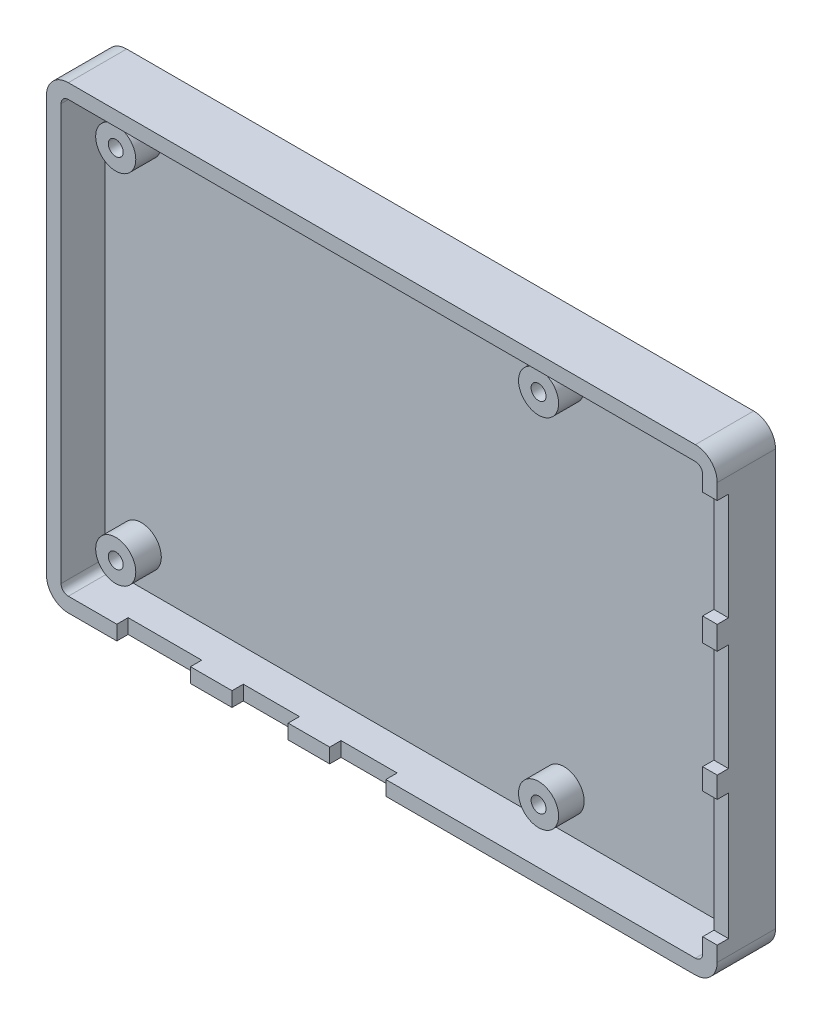
from build123d import *

# Parameters (mm, degrees)
CASEENVELOPE_W                       = 92
CASEENVELOPE_H                       = 63
BOTTOM_ENVELOPE_DEPTH                = 8
OUTSIDE_R3_R                         = 3
SHELL_1_T                            = -2
SIDEPORT_CLEARANCE_1_START           = 6.45
SIDEPORT_PROFILE_1_W                 = 10.1
SIDEPORT_PROFILE_1_H                 = 13
SIDEPORT_CLEARANCE_1_DEPTH           = 4.5
SIDEPORT_CLEARANCE_2_START           = 6.45
SIDEPORT_PROFILE_2_W                 = 7.7
SIDEPORT_PROFILE_2_H                 = 13
SIDEPORT_CLEARANCE_2_DEPTH           = 4.7
SIDEPORT_CLEARANCE_3_START           = 6.45
SIDEPORT_PROFILE_3_W                 = 7.7
SIDEPORT_PROFILE_3_H                 = 13
SIDEPORT_CLEARANCE_3_DEPTH           = 4.7
ENDPORT_CLEARANCE_1_START            = 6.45
ENDPORT_PROFILE_1_W                  = 11
ENDPORT_PROFILE_1_H                  = 17.3
ENDPORT_CLEARANCE_1_DEPTH            = 14.6
ENDPORT_CLEARANCE_2_START            = 6.45
ENDPORT_PROFILE_2_W                  = 11
ENDPORT_PROFILE_2_H                  = 14.7
ENDPORT_CLEARANCE_2_DEPTH            = 16.3
ENDPORT_CLEARANCE_3_START            = 6.45
ENDPORT_PROFILE_3_W                  = 11
ENDPORT_PROFILE_3_H                  = 14.7
ENDPORT_CLEARANCE_3_DEPTH            = 16.3
FOUR_M2P5_STANDOFFS_2P05_PILOT_START = 2
STANDOFF_RINGS_R                     = 2.75
STANDOFF_RINGS_R_2                   = 1.025
FOUR_M2P5_STANDOFFS_2P05_PILOT_DEPTH = 3.5


with BuildPart() as part:
    # CaseEnvelope → Bottom_Envelope (new body)
    with BuildSketch(Plane.XY):
        Rectangle(CASEENVELOPE_W, CASEENVELOPE_H)
    extrude(amount=BOTTOM_ENVELOPE_DEPTH)

    # Outside_R3
    outside_r3_edges = [part.edges().sort_by_distance(p)[0] for p in [
        (46, 31.5, 4),
        (46, -31.5, 4),
        (-46, 31.5, 4),
        (-46, -31.5, 4),
    ]]
    fillet(outside_r3_edges, radius=OUTSIDE_R3_R)

    # 抽壳1
    shell_1_openings = [part.faces().sort_by_distance(p)[0] for p in [
        (0, 0, 8),
    ]]
    offset(amount=SHELL_1_T, openings=shell_1_openings, kind=Kind.INTERSECTION)

    # SidePort_Profile_1 → SidePort_Clearance_1 (cut)
    with BuildSketch(Plane.XY.offset(SIDEPORT_CLEARANCE_1_START)):
        with Locations((-31.3, -33.5)):
            Rectangle(SIDEPORT_PROFILE_1_W, SIDEPORT_PROFILE_1_H)
    extrude(amount=SIDEPORT_CLEARANCE_1_DEPTH, mode=Mode.SUBTRACT)

    # SidePort_Profile_2 → SidePort_Clearance_2 (cut)
    with BuildSketch(Plane.XY.offset(SIDEPORT_CLEARANCE_2_START)):
        with Locations((-16.7, -33.5)):
            Rectangle(SIDEPORT_PROFILE_2_W, SIDEPORT_PROFILE_2_H)
    extrude(amount=SIDEPORT_CLEARANCE_2_DEPTH, mode=Mode.SUBTRACT)

    # SidePort_Profile_3 → SidePort_Clearance_3 (cut)
    with BuildSketch(Plane.XY.offset(SIDEPORT_CLEARANCE_3_START)):
        with Locations((-3.3, -33.5)):
            Rectangle(SIDEPORT_PROFILE_3_W, SIDEPORT_PROFILE_3_H)
    extrude(amount=SIDEPORT_CLEARANCE_3_DEPTH, mode=Mode.SUBTRACT)

    # EndPort_Profile_1 → EndPort_Clearance_1 (cut)
    with BuildSketch(Plane.XY.offset(ENDPORT_CLEARANCE_1_START)):
        with Locations((47.5, -17.8)):
            Rectangle(ENDPORT_PROFILE_1_W, ENDPORT_PROFILE_1_H)
    extrude(amount=ENDPORT_CLEARANCE_1_DEPTH, mode=Mode.SUBTRACT)

    # EndPort_Profile_2 → EndPort_Clearance_2 (cut)
    with BuildSketch(Plane.XY.offset(ENDPORT_CLEARANCE_2_START)):
        with Locations((47.5, 1.1)):
            Rectangle(ENDPORT_PROFILE_2_W, ENDPORT_PROFILE_2_H)
    extrude(amount=ENDPORT_CLEARANCE_2_DEPTH, mode=Mode.SUBTRACT)

    # EndPort_Profile_3 → EndPort_Clearance_3 (cut)
    with BuildSketch(Plane.XY.offset(ENDPORT_CLEARANCE_3_START)):
        with Locations((47.5, 19)):
            Rectangle(ENDPORT_PROFILE_3_W, ENDPORT_PROFILE_3_H)
    extrude(amount=ENDPORT_CLEARANCE_3_DEPTH, mode=Mode.SUBTRACT)

    # Standoff_Rings → Four_M2p5_Standoffs_2p05_Pilot (add)
    # profile 1 of 4: a face of its own
    with BuildSketch(Plane.XY.offset(FOUR_M2P5_STANDOFFS_2P05_PILOT_START)):
        with Locations((-39, -24.5)):
            Circle(STANDOFF_RINGS_R)
        with Locations((-39, -24.5)):
            Circle(STANDOFF_RINGS_R_2, mode=Mode.SUBTRACT)
    # profile 2 of 4: a face of its own
    with BuildSketch(Plane.XY.offset(FOUR_M2P5_STANDOFFS_2P05_PILOT_START)):
        with Locations((-39, 24.5)):
            Circle(STANDOFF_RINGS_R)
        with Locations((-39, 24.5)):
            Circle(STANDOFF_RINGS_R_2, mode=Mode.SUBTRACT)
    # profile 3 of 4: a face of its own
    with BuildSketch(Plane.XY.offset(FOUR_M2P5_STANDOFFS_2P05_PILOT_START)):
        with Locations((19, -24.5)):
            Circle(STANDOFF_RINGS_R)
        with Locations((19, -24.5)):
            Circle(STANDOFF_RINGS_R_2, mode=Mode.SUBTRACT)
    # profile 4 of 4: a face of its own
    with BuildSketch(Plane.XY.offset(FOUR_M2P5_STANDOFFS_2P05_PILOT_START)):
        with Locations((19, 24.5)):
            Circle(STANDOFF_RINGS_R)
        with Locations((19, 24.5)):
            Circle(STANDOFF_RINGS_R_2, mode=Mode.SUBTRACT)
    extrude(amount=FOUR_M2P5_STANDOFFS_2P05_PILOT_DEPTH)


solid = part.part
